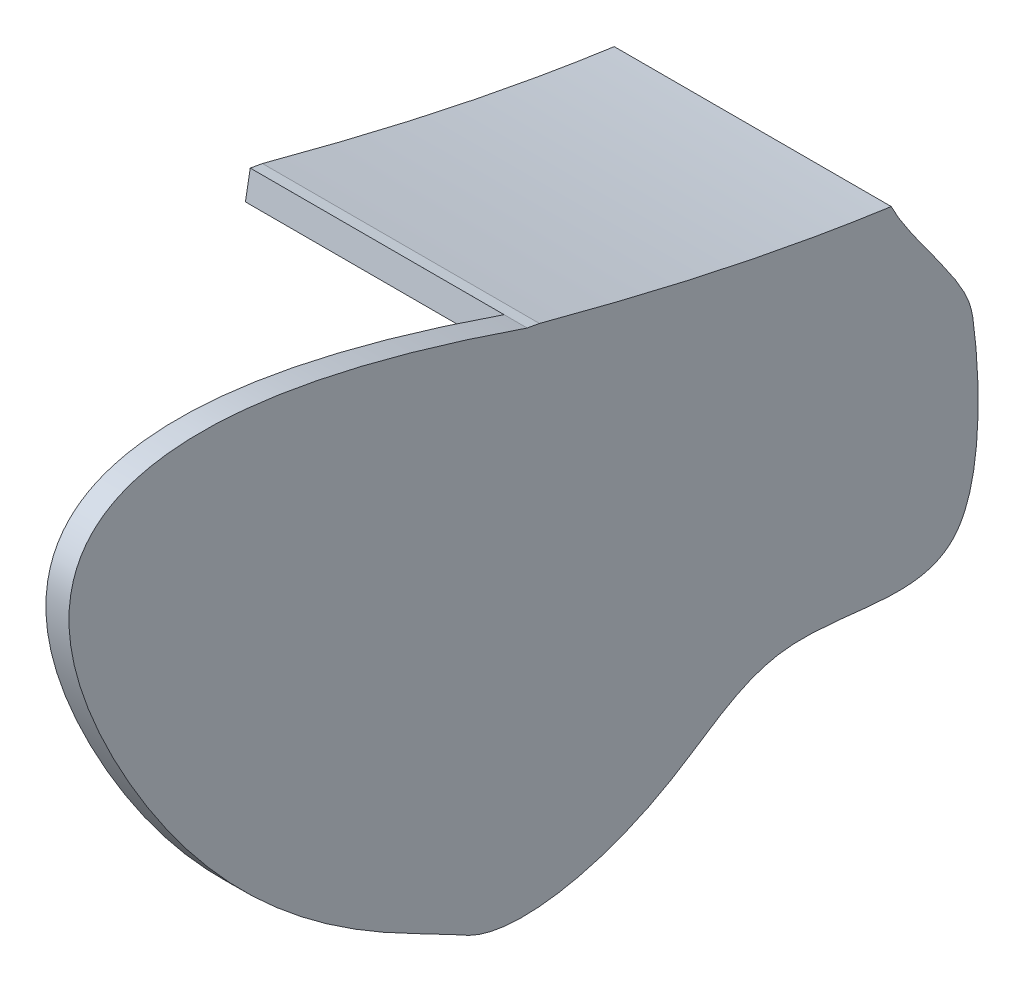
from build123d import *
from OCP.BRepAlgoAPI import BRepAlgoAPI_Cut
from OCP.TopTools import TopTools_ListOfShape

# Parameters (mm, degrees)
SKETCH5_W               = 81.787290023
SKETCH5_H               = 56.904635677
BOSS_EXTRUDE4_DEPTH     = 2.54
SKETCH8_W               = 27.940001339
SKETCH8_H               = 40.923748046
BOSS_EXTRUDE5_DEPTH     = 3.725366
CUT_EXTRUDE1_DEPTH      = 126.746493029
CUT_EXTRUDE1_DEPTH_BACK = 126.746493029
CUT_EXTRUDE2_DEPTH      = 127.33513904
CUT_EXTRUDE2_DEPTH_BACK = 127.33513904
BOSS_EXTRUDE6_REACH     = 128.584
SKETCH12_W              = 2.54
SKETCH12_H              = 35.085594769
BOSS_EXTRUDE7_REACH     = 73.221
SKETCH13_W              = 2.54
SKETCH13_H              = 27.369624292
BOSS_EXTRUDE8_REACH     = 111.618
SKETCH14_W              = 2.54
SKETCH14_H              = 37.73907017
BOSS_EXTRUDE9_REACH     = 134.62
BOSS_EXTRUDE10_REACH    = 73.568
SKETCH16_W              = 2.54
SKETCH16_H              = 4.106837018
CUT_EXTRUDE4_DEPTH      = 126.746493188
CUT_EXTRUDE4_DEPTH_BACK = 126.746493188
BOSS_EXTRUDE11_DEPTH    = 2.54
CUT_EXTRUDE5_DEPTH      = 176.067996905
CUT_EXTRUDE5_DEPTH_BACK = 176.067996905
SKETCH20_OUTSIDE_W      = 160.933
SKETCH20_OUTSIDE_H      = 133.978


with BuildPart() as part:
    # Sketch5 → Boss-Extrude4 (new body)
    with BuildSketch(Plane(origin=(0, 0, 0), x_dir=(0, 0, -1), z_dir=(1, 0, 0))):
        with Locations((-36.147875746, 66.92137305)):
            Rectangle(SKETCH5_W, SKETCH5_H)
    extrude(amount=BOSS_EXTRUDE4_DEPTH)

    # Sketch8 → Boss-Extrude5 (add)
    with BuildSketch(Plane(origin=(0, 77.402413142, -13.876271299), x_dir=(-1, 0, 0), z_dir=(0, -0.9843076044334547, 0.17646115678662544))):
        with Locations((13.97000067, -40.091856962)):
            Rectangle(SKETCH8_W, SKETCH8_H)
    extrude(amount=-BOSS_EXTRUDE5_DEPTH)

    # Sketch10 → Cut-Extrude1 (cut, two sides: drawn at the far end of the back side and taken through both)
    with BuildSketch(Plane(origin=(0, 0, 0), x_dir=(0, 0, -1), z_dir=(1, 0, 0)).offset(-CUT_EXTRUDE1_DEPTH_BACK)):
        with BuildLine():
            Line((-40.242521464, 96.388231012), (-45.049448936, 91.866554616))
            add(Edge.make_bspline(
                [(-45.049448936, 91.866554616), (-40.025208831, 90.523842434), (-26.810283978, 87.100327552), (-13.367287816, 84.471736542), (-5.009519635, 83.299208369)],
                knots=[0, 0, 0, 0, 0.380899762, 1, 1, 1, 1], degree=3))
            Line((-5.009519635, 83.299208369), (0.750455987, 86.657878486))
            Line((0.750455987, 86.657878486), (-40.242521464, 96.388231012))
        make_face()
    extrude(amount=CUT_EXTRUDE1_DEPTH + CUT_EXTRUDE1_DEPTH_BACK, mode=Mode.SUBTRACT)

    # Sketch11 → Cut-Extrude2 (cut, two sides: drawn at the far end of the back side and taken through both)
    with BuildSketch(Plane.ZY.offset(27.940001339).offset(-CUT_EXTRUDE2_DEPTH_BACK)):
        with BuildLine():
            Line((53.455872179, 90.683446735), (30.686323775, 63.989877738))
            Line((30.686323775, 63.989877738), (2.256807619, 78.898821665))
            Line((2.256807619, 78.898821665), (3.827754532, 81.664020072))
            Line((3.827754532, 81.664020072), (5.732550457, 81.13087175))
            add(Edge.make_bspline(
                [(5.732550457, 81.13087175), (24.123226432, 83.821086616), (37.047064255, 86.680580039), (53.455872179, 90.683446735)],
                knots=[0, 0, 0, 0, 1, 1, 1, 1], degree=3))
        make_face()
    extrude(amount=CUT_EXTRUDE2_DEPTH + CUT_EXTRUDE2_DEPTH_BACK, mode=Mode.SUBTRACT)

    # Sketch12 → Boss-Extrude6 (add, up to next)
    with BuildSketch(Plane(origin=(0, 11.798984957, -13.832378819), x_dir=(-1, 0, 0), z_dir=(0, 0.6489714241172663, -0.760812782936254)), mode=Mode.PRIVATE) as boss_extrude6_sk1:
        with Locations((-1.27, 86.141661588)):
            Rectangle(SKETCH12_W, SKETCH12_H)
    boss_extrude6_tool1 = extrude(boss_extrude6_sk1.sketch, amount=BOSS_EXTRUDE6_REACH, mode=Mode.PRIVATE) - part.part
    add(boss_extrude6_tool1.solids().sort_by_distance((1.27, 77.336662, 42.071098))[0])

    # Sketch13 → Boss-Extrude7 (add, up to next)
    with BuildSketch(Plane(origin=(0, 52.19089278, 44.518702594), x_dir=(1, 0, 0), z_dir=(0, -0.760812782936254, -0.6489714241172663)), mode=Mode.PRIVATE) as boss_extrude7_sk1:
        with Locations((1.27, -31.865866841)):
            Rectangle(SKETCH13_W, SKETCH13_H)
    boss_extrude7_tool1 = extrude(boss_extrude7_sk1.sketch, amount=BOSS_EXTRUDE7_REACH, mode=Mode.PRIVATE) - part.part
    add(boss_extrude7_tool1.solids().sort_by_distance((1.27, 72.87093, 20.274744))[0])

    # Sketch14 → Boss-Extrude8 (add, up to next)
    with BuildSketch(Plane(origin=(0, 82.204388232, -19.512553769), x_dir=(1, 0, 0), z_dir=(0, -0.9729657825072627, 0.2309493149373473)), mode=Mode.PRIVATE) as boss_extrude8_sk1:
        with Locations((1.27, 38.152944758)):
            Rectangle(SKETCH14_W, SKETCH14_H)
    boss_extrude8_tool1 = extrude(boss_extrude8_sk1.sketch, amount=BOSS_EXTRUDE8_REACH, mode=Mode.PRIVATE) - part.part
    add(boss_extrude8_tool1.solids().sort_by_distance((1.27, 91.015785, 17.608956))[0])

    # Boss-Extrude9: up to this plane
    boss_extrude9_end = Plane(origin=(2.54, 78.898821665, 2.256807619), z_dir=(0, 0.4939645898590634, -0.8694820204957474))
    # Sketch15 → Boss-Extrude9 (add, up to the surface)
    with BuildSketch(Plane(origin=(0, 29.561089012, -34.655538845), x_dir=(-1, 0, 0), z_dir=(0, 0.6489714241172663, -0.760812782936254)), mode=Mode.PRIVATE) as boss_extrude9_sk1:
        Polygon((-2.54, 62.385269317), (0, 62.385269317), (0, 68.598864198), (-2.54, 68.598864203), align=None)
    boss_extrude9_tool1 = split(extrude(boss_extrude9_sk1.sketch, amount=BOSS_EXTRUDE9_REACH, mode=Mode.PRIVATE), bisect_by=boss_extrude9_end, keep=Keep.BOTH, mode=Mode.PRIVATE)
    add(boss_extrude9_tool1.solids().sort_by_distance((1.27, 79.388291, 7.846941))[0])

    # Sketch16 → Boss-Extrude10 (add, up to next)
    with BuildSketch(Plane(origin=(0, 47.463510363, 40.486257073), x_dir=(1, 0, 0), z_dir=(1.7728912829201935e-15, -0.7608127829362537, -0.6489714241172665)), mode=Mode.PRIVATE) as boss_extrude10_sk1:
        with Locations((1.27, -47.604097496)):
            Rectangle(SKETCH16_W, SKETCH16_H)
    boss_extrude10_tool1 = extrude(boss_extrude10_sk1.sketch, amount=BOSS_EXTRUDE10_REACH, mode=Mode.PRIVATE) - part.part
    add(boss_extrude10_tool1.solids().sort_by_distance((1.27, 78.357209, 4.268451))[0])


with BuildPart() as cut_extrude4_tool:
    # Sketch17 → Cut-Extrude4 (new, two sides: drawn at the far end of the back side and taken through both)
    with BuildSketch(Plane.ZY.offset(-CUT_EXTRUDE4_DEPTH_BACK)):
        with BuildLine():
            Line((45.069844132, 91.75470098), (45.668000854, 102.56574737))
            Line((45.668000854, 102.56574737), (-10.169635765, 101.194481381))
            Line((-10.169635765, 101.194481381), (-11.297413525, 80.811098173))
            Line((-11.297413525, 80.811098173), (5.009519635, 83.299208369))
            add(Edge.make_bspline(
                [(37.283058909, 89.835032689), (34.836356296, 89.212401727), (24.175537631, 86.585139533), (13.367287816, 84.471736542), (5.009519635, 83.299208369)],
                knots=[0.195993982, 0.195993982, 0.195993982, 0.195993982, 0.380899762, 1, 1, 1, 1], degree=3))
            Line((37.283058909, 89.835032689), (41.348755126, 93.900728906))
            Line((41.348755126, 93.900728906), (43.724942227, 91.513594496))
            Line((43.724942227, 91.513594496), (45.069844132, 91.75470098))
        make_face()
    extrude(amount=CUT_EXTRUDE4_DEPTH + CUT_EXTRUDE4_DEPTH_BACK)


with BuildPart() as part_1:
    add(part.part)

    # Cut-Extrude4: cut by cut_extrude4_tool, with a tolerance
    cut_extrude4_stock = TopTools_ListOfShape()
    cut_extrude4_stock.Append(part_1.part.wrapped)
    cut_extrude4_tools = TopTools_ListOfShape()
    cut_extrude4_tools.Append(cut_extrude4_tool.part.wrapped)
    cut_extrude4_cut = BRepAlgoAPI_Cut()
    cut_extrude4_cut.SetArguments(cut_extrude4_stock)
    cut_extrude4_cut.SetTools(cut_extrude4_tools)
    cut_extrude4_cut.SetFuzzyValue(0.00001)
    cut_extrude4_cut.Build()
    add(Compound.cast(cut_extrude4_cut.Shape()).solids(), mode=Mode.REPLACE)

    # Sketch18 → Boss-Extrude11 (add)
    with BuildSketch(Plane.ZY):
        Polygon((47.575270178, 38.469055211), (45.823592432, 95.373690888), (45.045739537, 120.642856825), (118.790200904, 122.9129097), (121.493112727, 35.106683347), (47.575270178, 25.583905436), (31.914373272, 23.629088449), (31.914373272, 38.469055211), align=None)
    extrude(amount=-BOSS_EXTRUDE11_DEPTH)

    # Sketch20 outside → Cut-Extrude5 (cut, two sides: drawn at the far end of the back side and taken through both)
    with BuildSketch(Plane.ZY.offset(-CUT_EXTRUDE5_DEPTH_BACK)):
        with Locations((58.3735, 73.271)):
            Rectangle(SKETCH20_OUTSIDE_W, SKETCH20_OUTSIDE_H)
        with BuildLine():
            Line((5.009519635, 83.299208369), (3.96643719, 97.862894814))
            Line((3.96643719, 97.862894814), (45.069859962, 91.75461268))
            add(Edge.make_bspline(
                [(45.069859962, 91.75461268), (88.06671598, 106.598547486), (102.698921653, 96.352532959), (78.234192741, 49.115395141), (56.338800129, 40.133848451), (47.639419335, 34.459384276), (32.872594978, 36.782655684), (16.418610546, 50.57398562), (-5.600424532, 40.534614125), (-4.678510468, 63.68810403), (-3.362124029, 72.336771532), (3.144032383, 79.3685972), (5.009519635, 83.299208369)],
                knots=[0, 0, 0, 0, 0.141853326, 0.193044775, 0.364594631, 0.404896474, 0.59606321, 0.678759645, 0.810881607, 0.912493474, 0.931405313, 1, 1, 1, 1], degree=3))
        make_face(mode=Mode.SUBTRACT)
    extrude(amount=CUT_EXTRUDE5_DEPTH + CUT_EXTRUDE5_DEPTH_BACK, mode=Mode.SUBTRACT)


solid = part_1.part
